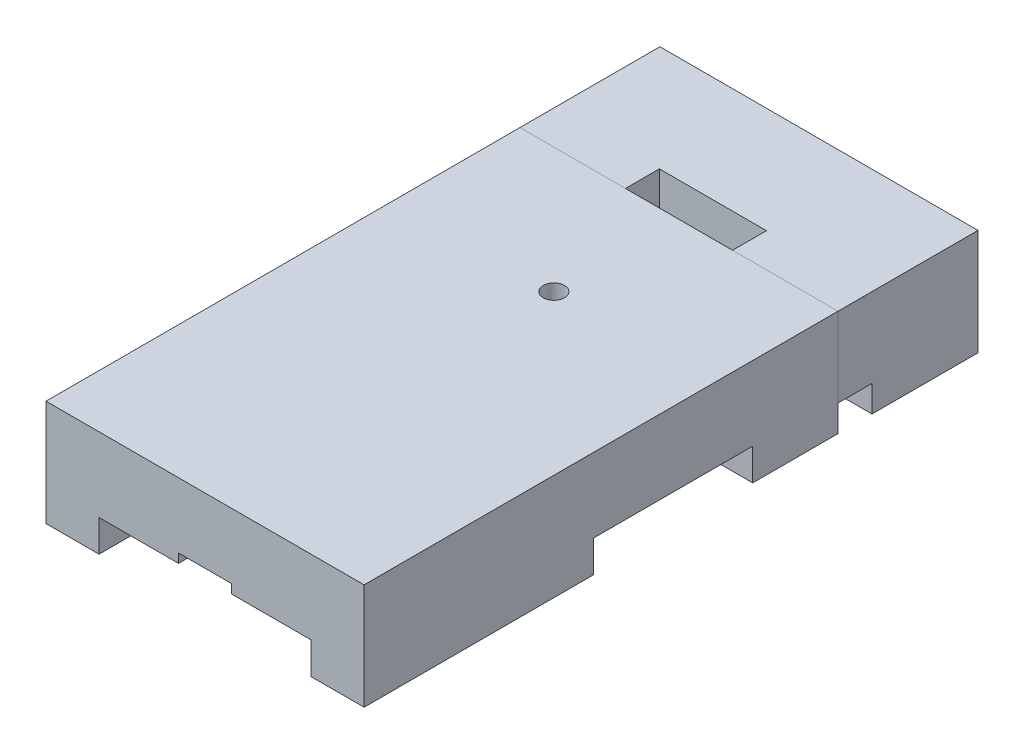
from build123d import *

# Parameters (mm, degrees)
BOSS_EXTRUDE1_DEPTH         = 12.7
BOSS_EXTRUDE1_DEPTH_BACK    = 12.7
SKETCH1_W                   = 76.2
SKETCH1_H                   = 147.066
SKETCH2_R                   = 4.7625
CUT_EXTRUDE1_DEPTH          = 25.4
CUT_EXTRUDE2_DEPTH          = 7.62
CUT_EXTRUDE4_DEPTH          = 84.785452729
CUT_EXTRUDE4_DEPTH_BACK     = 84.785452729
SKETCH5_W                   = 25.654
SKETCH5_H                   = 8.128
F_1_4_20_TAPPED_HOLE1_D     = 5.1054
F_1_4_20_TAPPED_HOLE1_DEPTH = 19.05
F_1_4_20_TAPPED_HOLE1_TIP   = 1.533816902
SKETCH9_R                   = 1.59639
F_8_32_TAPPED_HOLE_DEPTH    = 12.7
CUT_EXTRUDE7_DEPTH          = 2.159
SKETCH12_R                  = 2.0193
CUT_EXTRUDE8_DEPTH          = 12.7
SKETCH13_W                  = 25.273
SKETCH13_H                  = 8.128
CUT_EXTRUDE9_DEPTH          = 6.35
SKETCH15_R                  = 2.0193
CUT_EXTRUDE11_DEPTH         = 57.15
SKETCH17_R                  = 4.2164
CUT_EXTRUDE12_DEPTH         = 5.461
SKETCH19_R                  = 2.0193
CUT_EXTRUDE14_DEPTH         = 12.7
CUT_EXTRUDE16_DEPTH         = 2.286
CUT_EXTRUDE18_DEPTH         = 11.176


with BuildPart() as part:
    # Sketch1 → Boss-Extrude1 (new, two sides: drawn at the far end of the back side and taken through both)
    with BuildSketch(Plane(origin=(0, 0, 0), x_dir=(1, 0, 0), z_dir=(0, 1, 0)).offset(-BOSS_EXTRUDE1_DEPTH_BACK)):
        Rectangle(SKETCH1_W, SKETCH1_H)
    extrude(amount=BOSS_EXTRUDE1_DEPTH + BOSS_EXTRUDE1_DEPTH_BACK)

    # Sketch2 → Cut-Extrude1 (cut)
    with BuildSketch(Plane(origin=(0, 0, -73.533), x_dir=(-1, 0, 0), z_dir=(0, 0, -1))):
        with Locations((0, -12.7)):
            Circle(SKETCH2_R)
    extrude(amount=-CUT_EXTRUDE1_DEPTH, mode=Mode.SUBTRACT)

    # Sketch3 → Cut-Extrude2 (cut)
    with BuildSketch(Plane(origin=(0, -12.7, 0), x_dir=(-1, 0, 0), z_dir=(0, -1, 0))):
        with BuildLine():
            Line((10.922, 19.558), (44.45, 19.558))
            Line((44.45, 19.558), (44.45, -18.542))
            Line((44.45, -18.542), (25.4, -18.542))
            Line((25.4, -18.542), (25.4, -76.708))
            ThreePointArc((25.4, -76.708), (23.540128061, -81.198128061), (19.05, -83.058))
            Line((19.05, -83.058), (-19.05, -83.058))
            ThreePointArc((-19.05, -83.058), (-23.540128061, -81.198128061), (-25.4, -76.708))
            Line((-25.4, -76.708), (-25.4, -18.542))
            Line((-25.4, -18.542), (-44.45, -18.542))
            Line((-44.45, -18.542), (-44.45, 19.558))
            Line((-44.45, 19.558), (-10.922, 19.558))
            Line((-10.922, 19.558), (-10.922, 40.005))
            Line((-10.922, 40.005), (10.922, 40.005))
            Line((10.922, 40.005), (10.922, 19.558))
        make_face()
    extrude(amount=-CUT_EXTRUDE2_DEPTH, mode=Mode.SUBTRACT)

    # Sketch5 → Cut-Extrude4 (cut, two sides: drawn at the far end of the back side and taken through both)
    with BuildSketch(Plane(origin=(0, 0, 0), x_dir=(1, 0, 0), z_dir=(0, 1, 0)).offset(-CUT_EXTRUDE4_DEPTH_BACK)):
        with Locations((0, 44.069)):
            Rectangle(SKETCH5_W, SKETCH5_H)
    extrude(amount=CUT_EXTRUDE4_DEPTH + CUT_EXTRUDE4_DEPTH_BACK, mode=Mode.SUBTRACT)

    # 1/4-20 Tapped Hole1
    with Locations(Plane(origin=(-11.034450397, 12.7, 14.547513529), x_dir=(-1, 0, 0), z_dir=(0, 1, 0))):
        with Locations((-11.034450397, -24.580513529)):
            Hole(F_1_4_20_TAPPED_HOLE1_D / 2, depth=F_1_4_20_TAPPED_HOLE1_DEPTH)
            with Locations((0, 0, -(F_1_4_20_TAPPED_HOLE1_DEPTH + F_1_4_20_TAPPED_HOLE1_TIP / 2))):  # 118° drill point
                Cone(0, F_1_4_20_TAPPED_HOLE1_D / 2, F_1_4_20_TAPPED_HOLE1_TIP, mode=Mode.SUBTRACT)

    # Sketch9 → 8-32 Tapped Hole (cut)
    with BuildSketch(Plane(origin=(0, -12.7, 0), x_dir=(-1, 0, 0), z_dir=(0, -1, 0))):
        with Locations((31.75, 29.083)):
            Circle(SKETCH9_R)
        with Locations((31.75, -28.067)):
            Circle(SKETCH9_R)
        with Locations((-31.75, -28.067)):
            Circle(SKETCH9_R)
        with Locations((-31.75, 29.083)):
            Circle(SKETCH9_R)
    extrude(amount=-F_8_32_TAPPED_HOLE_DEPTH, mode=Mode.SUBTRACT)

    # Sketch11 → Cut-Extrude7 (cut)
    with BuildSketch(Plane(origin=(0, -5.08, 0), x_dir=(-1, 0, 0), z_dir=(0, -1, 0))):
        with BuildLine():
            Line((0.00254, -32.893), (-0.00254, -32.893))
            ThreePointArc((-0.00254, -32.893), (-4.490872009, -34.752127991), (-6.35, -39.24046))
            Line((-6.35, -39.24046), (-6.35, -73.533))
            Line((-6.35, -73.533), (6.35, -73.533))
            Line((6.35, -73.533), (6.35, -39.24046))
            ThreePointArc((6.35, -39.24046), (4.490872009, -34.752127991), (0.00254, -32.893))
        make_face()
    extrude(amount=-CUT_EXTRUDE7_DEPTH, mode=Mode.SUBTRACT)

    # Sketch12 → Cut-Extrude8 (cut)
    with BuildSketch(Plane.XZ.offset(5.08)):
        with Locations((12.7, 54.483)):
            Circle(SKETCH12_R)
        with Locations((-12.7, 54.483)):
            Circle(SKETCH12_R)
    extrude(amount=-CUT_EXTRUDE8_DEPTH, mode=Mode.SUBTRACT)

    # Sketch13 → Cut-Extrude9 (cut)
    with BuildSketch(Plane.XZ.offset(12.7)):
        with Locations((25.4635, -44.069)):
            Rectangle(SKETCH13_W, SKETCH13_H)
    extrude(amount=-CUT_EXTRUDE9_DEPTH, mode=Mode.SUBTRACT)

    # Sketch15 → Cut-Extrude11 (cut)
    with BuildSketch(Plane(origin=(0, 0, -73.533), x_dir=(-1, 0, 0), z_dir=(0, 0, -1))):
        with Locations((-24.13, 0)):
            Circle(SKETCH15_R)
        with Locations((24.13, 0)):
            Circle(SKETCH15_R)
    extrude(amount=-CUT_EXTRUDE11_DEPTH, mode=Mode.SUBTRACT)

    # Sketch17 → Cut-Extrude12 (cut)
    with BuildSketch(Plane(origin=(0, 0, -73.533), x_dir=(-1, 0, 0), z_dir=(0, 0, -1))):
        with Locations((-24.13, 0)):
            Circle(SKETCH17_R)
        with Locations((24.13, 0)):
            Circle(SKETCH17_R)
    extrude(amount=-CUT_EXTRUDE12_DEPTH, mode=Mode.SUBTRACT)

    # Sketch19 → Cut-Extrude14 (cut)
    with BuildSketch(Plane.XZ.offset(12.7)):
        with Locations((-31.75, -57.658)):
            Circle(SKETCH19_R)
        with Locations((-12.7, -57.658)):
            Circle(SKETCH19_R)
    extrude(amount=-CUT_EXTRUDE14_DEPTH, mode=Mode.SUBTRACT)

    # Sketch22 → Cut-Extrude16 (cut)
    with BuildSketch(Plane.XZ.offset(12.7)):
        with BuildLine():
            Line((-12.7, -35.90925), (12.7, -35.90925))
            ThreePointArc((12.7, -35.90925), (13.49375, -35.1155), (12.7, -34.32175))
            Line((12.7, -34.32175), (-12.7, -34.32175))
            ThreePointArc((-12.7, -34.32175), (-13.49375, -35.1155), (-12.7, -35.90925))
        make_face()
        with BuildLine():
            Line((-12.7, -23.65375), (12.7, -23.65375))
            ThreePointArc((12.7, -23.65375), (13.49375, -24.4475), (12.7, -25.24125))
            Line((12.7, -25.24125), (-12.7, -25.24125))
            ThreePointArc((-12.7, -25.24125), (-13.49375, -24.4475), (-12.7, -23.65375))
        make_face()
    extrude(amount=-CUT_EXTRUDE16_DEPTH, mode=Mode.SUBTRACT)

    # Sketch23 → Cut-Extrude18 (cut)
    with BuildSketch(Plane.XZ.offset(12.7)):
        with BuildLine():
            Line((-10.922, -40.005), (10.922, -40.005))
            Line((10.922, -40.005), (10.922, -22.733))
            ThreePointArc((10.922, -22.733), (9.99206403, -20.48793597), (7.747, -19.558))
            Line((7.747, -19.558), (-7.747, -19.558))
            ThreePointArc((-7.747, -19.558), (-9.99206403, -20.48793597), (-10.922, -22.733))
            Line((-10.922, -22.733), (-10.922, -40.005))
        make_face()
    extrude(amount=-CUT_EXTRUDE18_DEPTH, mode=Mode.SUBTRACT)


with BuildPart() as body_2:
    # Split1: the piece on the far side of the plane
    add(part.part)
    split(bisect_by=Plane(origin=(0, 0, -40.005), x_dir=(-1, 0, 0), z_dir=(0, 0, -1)), keep=Keep.BOTTOM)


with BuildPart() as part_1:
    add(part.part)

    # Split1
    split(bisect_by=Plane(origin=(0, 0, -40.005), x_dir=(-1, 0, 0), z_dir=(0, 0, -1)), keep=Keep.TOP)


solid = Compound([body_2.part, part_1.part])
